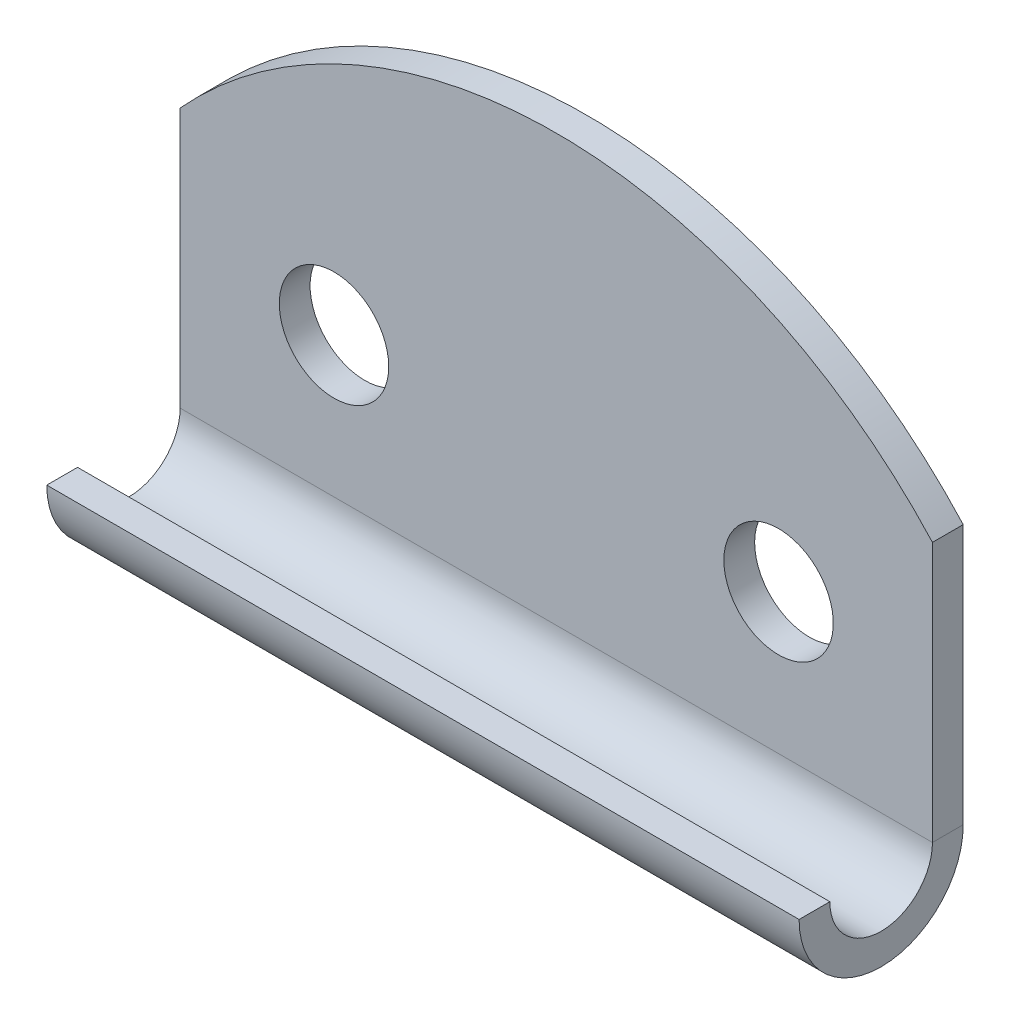
from build123d import *

# Parameters (mm, degrees)
SKETCH_1_R             = 1.6
SM_BASE_FLANGE_1_DEPTH = 0.9
OTHER_START            = -11
OTHER_1_DEPTH          = 22
OTHER_1_2_DEPTH        = 22


# Read off the part's stored shape, not the designer's step: 褶边1
# Sheet-metal steps are written as plain solids
with BuildPart() as part:
    # Sketch 1 → 基体-法兰1 (new body)
    with BuildSketch(Plane.XY):
        with BuildLine():
            Line((11, 0), (-11, 0))
            Line((-11, 0), (-11, 10))
            ThreePointArc((-11, 10), (0, 14.866068747), (11, 10))
            Line((11, 10), (11, 0))
        make_face()
        with Locations((-6.5, 6.5)):
            Circle(SKETCH_1_R, mode=Mode.SUBTRACT)
        with Locations(Location((6.5, 6.5, 0), (0, 0, 180))):
            Circle(SKETCH_1_R, mode=Mode.SUBTRACT)
    extrude(amount=-SM_BASE_FLANGE_1_DEPTH)

    # Other 1 outline → Other 1 (cut)
    with BuildSketch(Plane.YZ.offset(OTHER_START)):
        with BuildLine():
            ThreePointArc((2.4, -0.9), (1.360769515, -0.663330765), (0.5265006, 0))
            Line((0.5265006, 0), (0, 0))
            Line((0, 0), (0, -0.9))
            Line((0, -0.9), (2.4, -0.9))
        make_face()
    extrude(amount=OTHER_1_DEPTH, mode=Mode.SUBTRACT)

    # Other 1 2 outline → Other 1 2 (add)
    with BuildSketch(Plane.YZ.offset(OTHER_START)):
        with BuildLine():
            Line((2.4, 3), (2.4, 3.9))
            ThreePointArc((2.4, 3.9), (0.236669235, 2.539230485), (0.5265006, 0))
            Line((0.5265006, 0), (2.4, 0))
            ThreePointArc((2.4, 0), (0.9, 1.5), (2.4, 3))
        make_face()
    extrude(amount=OTHER_1_2_DEPTH)


solid = part.part
